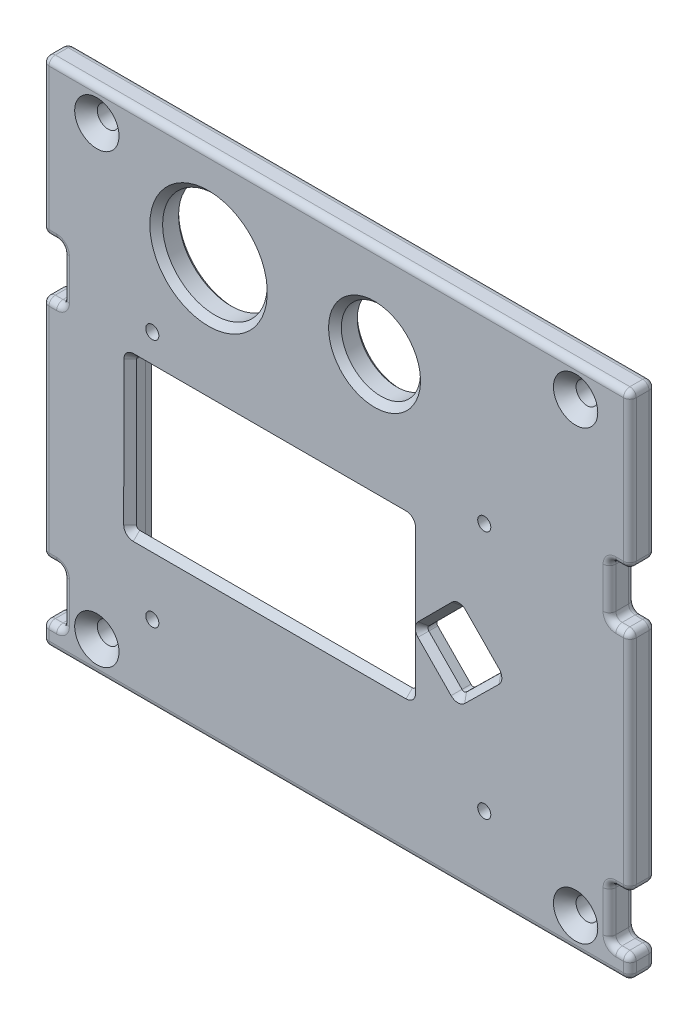
from build123d import *

# Parameters (mm, degrees)
SKETCH_1_W           = 92
SKETCH_1_H           = 80
EXTRUDE_1_DEPTH      = 4
FILLET_1_R           = 1
SKETCH_5_R           = 8.199999999999998
SKETCH_5_R_2         = 6.200000000000001
CUT_EXTRUDE_1_DEPTH  = 10
CUT_EXTRUDE_2_DEPTH  = 10
SKETCH_10_W          = 43.73798359101122
SKETCH_10_H          = 4.799999999999997
EXTRUDE_3_DEPTH      = 1
HOLE_WIZARD_M2_5_1_D = 2.05
CUT_EXTRUDE_4_DEPTH  = 1.6
SKETCH_13_W          = 7.00000000000005
SKETCH_13_H          = 7.000000000000006
SKETCH_13_R          = 1.0249999999999981
SKETCH_13_W_2        = 7.0000000000000355
SKETCH_13_H_2        = 7.000000000000021
SKETCH_13_W_3        = 6.999999999999954
SKETCH_13_W_4        = 6.999999999999968
SKETCH_13_H_3        = 7
EXTRUDE_4_DEPTH      = 1
FILLET_6_R           = 2
FILLET_3_R           = 0.5
CHAMFER_1_SIZE       = 1
CUT_EXTRUDE_3_DEPTH  = 3.2
FILLET_5_R           = 1
CHAMFER_2_SIZE       = 0.5
CHAMFER_3_SIZE       = 0.6


# Read off the part's stored shape, not the designer's step: M3 六角凹锥坑头螺钉的锥形沉头孔1
# Some blends are built 0.0001 mm under size
with BuildPart() as part:
    # 草图1 → 凸台-拉伸1 (new body)
    with BuildSketch(Plane.XY):
        Rectangle(SKETCH_1_W, SKETCH_1_H)
    extrude(amount=EXTRUDE_1_DEPTH)

    # 圆角1
    fillet_1_edges = [part.edges().sort_by_distance(p)[0] for p in [
        (46, -40, 2),
        (-46, -40, 2),
        (-46, 40, 2),
        (46, 40, 2),
    ]]
    fillet(fillet_1_edges, radius=FILLET_1_R)

    # 草图5 → 切除-拉伸1 (cut)
    with BuildSketch(Plane.XY.offset(4)):
        with Locations((-20.000000000000004, 25.4)):
            Circle(SKETCH_5_R)
        with Locations((5.999999999999995, 25.4)):
            Circle(SKETCH_5_R_2)
    extrude(amount=-CUT_EXTRUDE_1_DEPTH, mode=Mode.SUBTRACT)

    # 草图7 → 切除-拉伸2 (cut)
    with BuildSketch(Plane.XY.offset(4)):
        Polygon((11.437299974599982, 5.612700025400014), (-32.26201734237539, 5.612700025400005), (-32.30068361641124, -22.6872999746), (11.437299974599982, -22.687299974599995), align=None)
        Polygon((19.200336622309187, -2.5041402708626674), (25.146936780987943, -8.5702680987384), (19.054088686317147, -14.57075943490697), (13.163673741886969, -8.550780354971936), align=None)
    extrude(amount=-CUT_EXTRUDE_2_DEPTH, mode=Mode.SUBTRACT)

    # 草图10 → 凸台-拉伸3 (add)
    with BuildSketch(Plane.XY.offset(4)):
        with Locations((-10.43169182090563, -20.2872999746)):
            Rectangle(SKETCH_10_W, SKETCH_10_H)
    extrude(amount=-EXTRUDE_3_DEPTH)

    # M2.5 螺纹孔1 (through all)
    with Locations(Plane(origin=(0, 0, 0), x_dir=(-1, 0, 0), z_dir=(0, 0, -1))):
        with Locations((-23.187409195, -27.987294895), (28.812694945, -27.987294895), (28.812694945, 11.012783846), (-23.187409195, 11.012783846)):
            Hole(HOLE_WIZARD_M2_5_1_D / 2)

    # 草图12 → 切除-拉伸4 (cut)
    with BuildSketch(Plane(origin=(0, 0, 0), x_dir=(-1, 0, 0), z_dir=(0, 0, -1))):
        Polygon((32.31269494539003, -31.487294894589997), (-26.687409194817977, -31.487294894590004), (-26.687409194817985, 14.512783845568006), (32.31269494539002, 14.512783845568013), align=None)
    extrude(amount=-CUT_EXTRUDE_4_DEPTH, mode=Mode.SUBTRACT)

    # 草图13 → 凸台-拉伸4 (add)
    # profile 1 of 4: a face of its own
    with BuildSketch(Plane(origin=(0, 0, 1.6), x_dir=(-1, 0, 0), z_dir=(0, 0, -1))):
        with Locations((-23.18740919481796, 11.012783845568002)):
            Rectangle(SKETCH_13_W, SKETCH_13_H)
        with Locations((-23.18740919481796, 11.012783845568002)):
            Circle(SKETCH_13_R, mode=Mode.SUBTRACT)
    # profile 2 of 4: a face of its own
    with BuildSketch(Plane(origin=(0, 0, 1.6), x_dir=(-1, 0, 0), z_dir=(0, 0, -1))):
        with Locations((-23.18740919481796, -27.987294894589994)):
            Rectangle(SKETCH_13_W_2, SKETCH_13_H_2)
        with Locations((-23.18740919481796, -27.987294894589994)):
            Circle(SKETCH_13_R, mode=Mode.SUBTRACT)
    # profile 3 of 4: a face of its own
    with BuildSketch(Plane(origin=(0, 0, 1.6), x_dir=(-1, 0, 0), z_dir=(0, 0, -1))):
        with Locations((28.812694945390042, 11.012783845568004)):
            Rectangle(SKETCH_13_W_3, SKETCH_13_H_2)
        with Locations((28.812694945390042, 11.012783845568002)):
            Circle(SKETCH_13_R, mode=Mode.SUBTRACT)
    # profile 4 of 4: a face of its own
    with BuildSketch(Plane(origin=(0, 0, 1.6), x_dir=(-1, 0, 0), z_dir=(0, 0, -1))):
        with Locations((28.812694945390042, -27.987294894589994)):
            Rectangle(SKETCH_13_W_4, SKETCH_13_H_3)
        with Locations((28.812694945390042, -27.987294894589994)):
            Circle(SKETCH_13_R, mode=Mode.SUBTRACT)
    extrude(amount=EXTRUDE_4_DEPTH)

    # 圆角6
    fillet_6_edges = [part.edges().sort_by_distance(p)[0] for p in [
        (26.687409194817985, 14.512783845568006, 0.30000000000000004),
        (26.687409194817985, 7.512783845567999, 1.1),
        (19.687409194817935, 7.512783845567999, 1.1),
        (19.687409194817935, 14.512783845568006, 1.1),
        (26.687409194817977, -31.487294894590004, 0.30000000000000004),
        (19.687409194817942, -31.487294894590004, 1.1),
        (19.687409194817942, -24.487294894589986, 1.1),
        (26.687409194817977, -24.487294894589986, 1.1),
        (-32.31269494539002, 14.512783845568013, 0.30000000000000004),
        (-25.312694945390067, 14.512783845568013, 1.1),
        (-25.312694945390067, 7.512783845567992, 1.1),
        (-32.31269494539002, 7.512783845567992, 1.1),
        (-32.31269494539003, -31.487294894589997, 0.30000000000000004),
        (-32.31269494539003, -24.487294894589994, 1.1),
        (-25.31269494539006, -24.487294894589994, 1.1),
        (-25.31269494539006, -31.487294894589997, 1.1),
    ]]
    fillet(fillet_6_edges, radius=FILLET_6_R)

    # 圆角3
    fillet_3_edges = [part.edges().sort_by_distance(p)[0] for p in [
        (11.437299974599982, -17.8872999746, 3.5),
        (-32.29412537911894, -17.8872999746, 3.5),
        (11.437299974599982, -22.687299974599995, 2.3),
        (11.437299974599982, 5.612700025400014, 2.8),
        (-32.26201734237539, 5.612700025400005, 2.8),
        (-32.30068361641124, -22.6872999746, 2.3),
        (13.163673741886969, -8.550780354971936, 2.8),
        (19.054088686317147, -14.57075943490697, 2.8),
        (25.146936780987943, -8.5702680987384, 2.8),
        (19.200336622309187, -2.5041402708626674, 2.8),
    ]]
    fillet(fillet_3_edges, radius=FILLET_3_R)

    # 倒角1
    # the kernel refuses this chamfer: 1 mm, written as the material it takes off along each edge
    with BuildSketch(Plane(origin=(10.937299974599982, -17.8872999746, 4), x_dir=(0, -0.9996219169112968, 0.02749587661058651), z_dir=(-1, 0, 0))) as chamfer_1_piece_1:
        Polygon((CHAMFER_1_SIZE * 0.999621916911, -CHAMFER_1_SIZE * 0.0274958766106), (-CHAMFER_1_SIZE * 0.0274958766106, -CHAMFER_1_SIZE * 0.999621916911), (0, 0), align=None)
    extrude(amount=42.73074173730765, mode=Mode.SUBTRACT)
    with BuildSketch(Plane(origin=(10.937299974599982, -17.3872999746, 4), x_dir=(0, -1, 0), z_dir=(-1, 0, 0))) as chamfer_1_piece_2:
        Polygon((0.5 + CHAMFER_1_SIZE, 0), (0.5, -CHAMFER_1_SIZE), (0.5, 0), align=None)
    revolve(axis=Axis((10.937299974599982, -17.3872999746, 4), (0, 0, 1)), revolution_arc=90, mode=Mode.SUBTRACT)
    with BuildSketch(Plane(origin=(-31.793441762707673, -17.3872999746, 4), x_dir=(0, -1, 0), z_dir=(1, 0, 0))) as chamfer_1_piece_3:
        Polygon((0.5 + CHAMFER_1_SIZE, 0), (0.5, CHAMFER_1_SIZE), (0.5, 0), align=None)
    revolve(axis=Axis((-31.793441762707673, -17.3872999746, 4), (0, 0, -1)), revolution_arc=90.07828314251567, mode=Mode.SUBTRACT)
    with BuildSketch(Plane(origin=(11.437299974599982, -17.3872999746, 4), x_dir=(0.9996219169112968, 0, 0.02749587661058651), z_dir=(0, 1, 0))) as chamfer_1_piece_4:
        Polygon((CHAMFER_1_SIZE * 0.999621916911, CHAMFER_1_SIZE * 0.0274958766106), (-CHAMFER_1_SIZE * 0.0274958766106, CHAMFER_1_SIZE * 0.999621916911), (0, 0), align=None)
    extrude(amount=22.500000000000018, mode=Mode.SUBTRACT)
    with BuildSketch(Plane(origin=(-32.26269955870713, 5.113383174480311, 4), x_dir=(-0.9996209838784267, 0.001365781586382819, 0.02749587661058652), z_dir=(-0.0013662981606114724, -0.9999990666142325, 0))) as chamfer_1_piece_5:
        Polygon((CHAMFER_1_SIZE * 0.999621916911, CHAMFER_1_SIZE * 0.0274958766106), (-CHAMFER_1_SIZE * 0.0274958766106, CHAMFER_1_SIZE * 0.999621916911), (0, 0), align=None)
    extrude(amount=22.500021001199375, mode=Mode.SUBTRACT)
    with BuildSketch(Plane(origin=(10.937299974599982, 5.112700025400015, 4), x_dir=(1, 1.78e-15, 0), z_dir=(1.78e-15, -1, 0))) as chamfer_1_piece_6:
        Polygon((0.5 + CHAMFER_1_SIZE, 0), (0.5, -CHAMFER_1_SIZE), (0.5, 0), align=None)
    revolve(axis=Axis((10.937299974599982, 5.112700025400015, 4), (0, 0, 1)), revolution_arc=89.9999999999999, mode=Mode.SUBTRACT)
    with BuildSketch(Plane(origin=(-31.762700025400015, 5.112700025400005, 4), x_dir=(-0.9999990666142327, 0.0013662981606117287, 0), z_dir=(-0.0013662981606117287, -0.9999990666142327, 0))) as chamfer_1_piece_7:
        Polygon((0.5000000000000021 + CHAMFER_1_SIZE, 0), (0.5000000000000021, CHAMFER_1_SIZE), (0.5000000000000021, 0), align=None)
    revolve(axis=Axis((-31.762700025400015, 5.112700025400005, 4), (0, 0, -1)), revolution_arc=89.92171685748433, mode=Mode.SUBTRACT)
    with BuildSketch(Plane(origin=(10.937299974599982, 5.612700025400014, 4), x_dir=(0, 0.9996219169112968, 0.027495876610586487), z_dir=(-1, -2e-16, 0))) as chamfer_1_piece_8:
        Polygon((CHAMFER_1_SIZE * 0.999621916911, CHAMFER_1_SIZE * 0.0274958766106), (-CHAMFER_1_SIZE * 0.0274958766106, CHAMFER_1_SIZE * 0.999621916911), (0, 0), align=None)
    extrude(amount=42.699999999999996, mode=Mode.SUBTRACT)
    with BuildSketch(Plane(origin=(24.791516701281584, -8.920300641129165, 4), x_dir=(0.7014208532427678, -0.7122167952285337, 0.027495876610586514), z_dir=(-0.7124861742019344, -0.7016861489092477, 0))) as chamfer_1_piece_9:
        Polygon((CHAMFER_1_SIZE * 0.999621916911, -CHAMFER_1_SIZE * 0.0274958766106), (-CHAMFER_1_SIZE * 0.0274958766106, -CHAMFER_1_SIZE * 0.999621916911), (0, 0), align=None)
    extrude(amount=7.551063691821667, mode=Mode.SUBTRACT)
    with BuildSketch(Plane(origin=(19.060645145885807, -13.862534356110986, 4), x_dir=(0.7016861489092451, -0.7124861742019372, 0), z_dir=(0.7124861742019372, 0.7016861489092451, 0))) as chamfer_1_piece_10:
        Polygon((0.5000000000000011 + CHAMFER_1_SIZE, 0), (0.5000000000000011, CHAMFER_1_SIZE), (0.5000000000000011, 0), align=None)
    revolve(axis=Axis((19.060645145885807, -13.862534356110986, 4), (0, 0, -1)), revolution_arc=90.18569370135687, mode=Mode.SUBTRACT)
    with BuildSketch(Plane(origin=(24.44067362682696, -8.564057554028196, 4), x_dir=(0.7016861489092467, -0.7124861742019353, 0), z_dir=(-0.7124861742019353, -0.7016861489092467, 0))) as chamfer_1_piece_11:
        Polygon((0.4999999999999997 + CHAMFER_1_SIZE, 0), (0.500000000000001, -CHAMFER_1_SIZE), (0.4999999999999997, 0), align=None)
    revolve(axis=Axis((24.44067362682696, -8.564057554028196, 4), (0, 0, 1)), revolution_arc=89.86747992197152, mode=Mode.SUBTRACT)
    with BuildSketch(Plane(origin=(18.70326686109107, -14.212221018077338, 4), x_dir=(-0.7144863322179773, -0.6991089027062363, 0.027495876610586452), z_dir=(-0.6993733239327053, 0.7147565695894786, 0))) as chamfer_1_piece_12:
        Polygon((CHAMFER_1_SIZE * 0.999621916911, -CHAMFER_1_SIZE * 0.0274958766106), (-CHAMFER_1_SIZE * 0.0274958766106, -CHAMFER_1_SIZE * 0.999621916911), (0, 0), align=None)
    extrude(amount=7.4266133391607765, mode=Mode.SUBTRACT)
    with BuildSketch(Plane(origin=(19.554146873995485, -2.865062168463199, 4), x_dir=(0.7138372132482123, 0.6997716840166097, 0.027495876610586497), z_dir=(0.7000363559242622, -0.714107205105984, 0))) as chamfer_1_piece_13:
        Polygon((CHAMFER_1_SIZE * 0.999621916911, -CHAMFER_1_SIZE * 0.0274958766106), (-CHAMFER_1_SIZE * 0.0274958766106, -CHAMFER_1_SIZE * 0.999621916911), (0, 0), align=None)
    extrude(amount=7.490440047876282, mode=Mode.SUBTRACT)
    with BuildSketch(Plane(origin=(13.86666988931397, -8.554313682144963, 4), x_dir=(-0.7147565695894776, -0.6993733239327063, 0), z_dir=(0.6993733239327063, -0.7147565695894776, 0))) as chamfer_1_piece_14:
        Polygon((0.500000000000001 + CHAMFER_1_SIZE, 0), (0.4999999999999998, CHAMFER_1_SIZE), (0.500000000000001, 0), align=None)
    revolve(axis=Axis((13.86666988931397, -8.554313682144963, 4), (0, 0, -1)), revolution_arc=89.32943807985053, mode=Mode.SUBTRACT)
    with BuildSketch(Plane(origin=(19.197093271442494, -3.21508034642533, 4), x_dir=(0.7141072051059829, 0.700036355924263, 0), z_dir=(0.700036355924263, -0.7141072051059829, 0))) as chamfer_1_piece_15:
        Polygon((0.49999999999999944 + CHAMFER_1_SIZE, 0), (0.5000000000000004, -CHAMFER_1_SIZE), (0.49999999999999944, 0), align=None)
    revolve(axis=Axis((19.197093271442494, -3.21508034642533, 4), (0, 0, 1)), revolution_arc=90.61738829682062, mode=Mode.SUBTRACT)
    with BuildSketch(Plane(origin=(13.512824689711183, -8.201052341607875, 4), x_dir=(-0.7074228334336008, 0.706255556796682, 0.02749587661058647), z_dir=(0.7065226810741815, 0.7076903992055782, 0))) as chamfer_1_piece_16:
        Polygon((CHAMFER_1_SIZE * 0.999621916911, -CHAMFER_1_SIZE * 0.0274958766106), (-CHAMFER_1_SIZE * 0.0274958766106, -CHAMFER_1_SIZE * 0.999621916911), (0, 0), align=None)
    extrude(amount=7.544589190009113, mode=Mode.SUBTRACT)
    with BuildSketch(Plane(origin=(-20.000000000000004, 25.4, 4), x_dir=(1, 0, 0), z_dir=(0, -1, 0))) as chamfer_1_piece_17:
        Polygon((8.199999999999998 + CHAMFER_1_SIZE, 0), (8.199999999999998, -CHAMFER_1_SIZE), (8.199999999999998, 0), align=None)
    revolve(axis=Axis((-20.000000000000004, 25.4, 4), (0, 0, 1)), mode=Mode.SUBTRACT)
    with BuildSketch(Plane(origin=(5.999999999999995, 25.4, 4), x_dir=(1, 0, 0), z_dir=(0, -1, 0))) as chamfer_1_piece_18:
        Polygon((6.200000000000001 + CHAMFER_1_SIZE, 0), (6.200000000000001, -CHAMFER_1_SIZE), (6.200000000000001, 0), align=None)
    revolve(axis=Axis((5.999999999999995, 25.4, 4), (0, 0, 1)), mode=Mode.SUBTRACT)

    # 草图11 → 切除-拉伸3 (cut)
    with BuildSketch(Plane.ZY.offset(46)):
        with BuildLine():
            Line((4.222567200682733, 15.824999999999774), (4.222567200682733, 7.42499999999978))
            Line((4.222567200682733, 7.42499999999978), (-5.977432799317274, 7.42499999999978))
            ThreePointArc((-5.977432799317274, 7.42499999999978), (-10.177432799317266, 11.624999999999783), (-5.977432799317271, 15.824999999999774))
            Line((-5.977432799317271, 15.824999999999774), (4.222567200682733, 15.824999999999774))
        make_face()
        with BuildLine():
            Line((4.2225672006827075, -28.050000000000242), (-5.977432799317311, -28.050000000000242))
            ThreePointArc((-5.977432799317311, -28.050000000000242), (-10.177432799317293, -32.25000000000021), (-5.977432799317323, -36.450000000000216))
            Line((-5.977432799317323, -36.450000000000216), (4.2225672006827075, -36.45000000000021))
            Line((4.2225672006827075, -36.45000000000021), (4.2225672006827075, -28.050000000000242))
        make_face()
        with BuildLine():
            Line((-5.977432799317244, 51.49999999999978), (4.022567200682756, 51.499999999999766))
            Line((4.022567200682756, 51.499999999999766), (4.022567200682734, 15.624999999999773))
            Line((4.022567200682734, 15.624999999999773), (-5.977432799317271, 15.624999999999782))
            ThreePointArc((-5.977432799317271, 15.624999999999782), (-9.977432799317274, 11.624999999999783), (-5.977432799317274, 7.62499999999978))
            Line((-5.977432799317274, 7.62499999999978), (4.0225672006827295, 7.624999999999764))
            Line((4.0225672006827295, 7.624999999999764), (4.022567200682707, -28.25000000000024))
            Line((4.022567200682707, -28.25000000000024), (-5.977432799317311, -28.250000000000227))
            ThreePointArc((-5.977432799317311, -28.250000000000227), (-9.977432799317308, -32.25000000000021), (-5.977432799317323, -36.25000000000021))
            Line((-5.977432799317323, -36.25000000000021), (4.022567200682703, -36.25000000000023))
            Line((4.022567200682703, -36.25000000000023), (4.022567200682702, -38.00000000000021))
            Line((4.022567200682702, -38.00000000000021), (8.922567200682705, -38.00000000000021))
            Line((8.922567200682705, -38.00000000000021), (8.922567200682781, 90.49999999999979))
            Line((8.922567200682781, 90.49999999999979), (4.02256720068278, 90.49999999999979))
            Line((4.02256720068278, 90.49999999999979), (4.0225672006827615, 59.499999999999766))
            Line((4.0225672006827615, 59.499999999999766), (-5.9774327993172385, 59.499999999999766))
            ThreePointArc((-5.9774327993172385, 59.499999999999766), (-9.977432799317235, 55.49999999999978), (-5.977432799317244, 51.49999999999978))
        make_face()
    cut_extrude_3 = extrude(amount=-CUT_EXTRUDE_3_DEPTH, mode=Mode.SUBTRACT)

    # 镜向2: 切除-拉伸3 across plane
    add(cut_extrude_3.mirror(Plane(origin=(0, 0, 0), x_dir=(0, 0, 1), z_dir=(1, 0, 0))), mode=Mode.SUBTRACT)

    # 圆角5
    fillet_5_edges = [part.edges().sort_by_distance(p)[0] for p in [
        (46, -37.72500000000011, 0),
        (46, -37.72500000000011, 4),
        (0, -40, 0),
        (-46, 27.412499999999888, 0),
        (0, 40, 0),
        (45.707106781186546, 39.707106781186546, 0),
        (-45.707106781186546, 39.707106781186546, 0),
        (-45.707106781186546, -39.707106781186546, 0),
        (45.707106781186546, -39.707106781186546, 0),
        (0, -40, 4),
        (0, 40, 4),
        (-46, 27.412499999999888, 4),
        (45.707106781186546, 39.707106781186546, 4),
        (-45.707106781186546, 39.707106781186546, 4),
        (-45.707106781186546, -39.707106781186546, 4),
        (45.707106781186546, -39.707106781186546, 4),
        (-46, -10.312500000000227, 0),
        (-46, -37.72500000000011, 0),
        (-46, -10.312500000000227, 4),
        (-46, -37.72500000000011, 4),
        (-46, 7.42499999999978, 2),
        (-46, 15.824999999999774, 1.9999999999999991),
        (-46, -36.45000000000021, 2.000000000000001),
        (-46, -28.050000000000242, 2),
        (-42.8, 11.624999999999778, 0),
        (-42.8, -32.25000000000023, 0),
        (-44.4, -28.050000000000242, 4),
        (-42.8, -28.050000000000242, 2),
        (-44.4, -28.050000000000242, 0),
        (-42.8, -36.45000000000021, 2.000000000000001),
        (-44.4, -36.45000000000021, 4),
        (-44.4, -36.45000000000021, 0),
        (-42.8, -32.25000000000023, 4),
        (-44.4, 15.824999999999774, 3.9999999999999996),
        (-42.8, 15.824999999999774, 1.9999999999999991),
        (-44.4, 15.824999999999774, 0),
        (-42.8, 7.42499999999978, 2),
        (-44.4, 7.42499999999978, 4),
        (-44.4, 7.42499999999978, 0),
        (-42.8, 11.624999999999778, 4),
        (46, -10.312500000000231, 4),
        (46, 27.41249999999988, 4),
        (46, -10.312500000000231, 0),
        (46, 27.41249999999988, 0),
        (46, 7.42499999999978, 2),
        (46, 15.824999999999774, 1.9999999999999991),
        (46, -36.45000000000021, 2.000000000000001),
        (46, -28.050000000000242, 2),
        (42.8, 11.624999999999778, 0),
        (42.8, -32.25000000000023, 0),
        (42.8, -28.050000000000242, 2),
        (42.8, -36.45000000000021, 2.000000000000001),
        (44.4, -28.050000000000242, 0),
        (44.4, -36.45000000000021, 0),
        (44.4, -28.050000000000242, 4),
        (44.4, -36.45000000000021, 4),
        (42.8, -32.25000000000023, 4),
        (42.8, 15.824999999999774, 1.9999999999999991),
        (42.8, 7.42499999999978, 2),
        (44.4, 15.824999999999774, 0),
        (44.4, 7.42499999999978, 0),
        (44.4, 15.824999999999774, 3.9999999999999996),
        (44.4, 7.42499999999978, 4),
        (42.8, 11.624999999999778, 4),
    ]]
    fillet(fillet_5_edges, radius=FILLET_5_R)

    # 倒角2
    chamfer_2_edges = [part.edges().sort_by_distance(p)[0] for p in [
        (-28.200000000000003, 25.4, 0),
        (-0.2000000000000064, 25.4, 0),
    ]]
    chamfer(chamfer_2_edges, length=CHAMFER_2_SIZE)

    # 倒角3
    chamfer_3_edges = [part.edges().sort_by_distance(p)[0] for p in [
        (-2.812642875286027, -31.48729489459, 0),
        (-31.726908507763124, -30.901508456963093, 0),
        (26.10162275719107, -30.9015084569631, 0),
        (-32.31269494539002, -8.487255524510992, 0),
        (26.68740919481798, -8.487255524511, 0),
        (-31.726908507763117, 13.926997407941109, 0),
        (26.10162275719108, 13.926997407941101, 0),
        (-2.81264287528602, 14.51278384556801, 0),
    ]]
    chamfer(chamfer_3_edges, length=CHAMFER_3_SIZE - 0.0001)  # a hair under: the kernel refuses the full size

    # M3 六角凹锥坑头螺钉的锥形沉头孔1 outline → M3 六角凹锥坑头螺钉的锥形沉头孔1 (revolve, cut)
    with BuildSketch(Plane(origin=(37.5, 35, 0), x_dir=(1, 0, 0), z_dir=(0, -1, 0))):
        Polygon((0, 0), (1.7, 0), (1.7, 2.23), (3.47, 4), (0, 4), align=None)
    revolve(axis=Axis((37.5, 35, 0), (0, 0, 1)), mode=Mode.SUBTRACT)

    # Hole Wizard M3 _1 2 outline → Hole Wizard M3 _1 2 (revolve, cut)
    with BuildSketch(Plane(origin=(-37.5, -35, 0), x_dir=(1, 0, 0), z_dir=(0, -1, 0))):
        Polygon((0, 0), (1.7, 0), (1.7, 2.23), (3.47, 4), (0, 4), align=None)
    revolve(axis=Axis((-37.5, -35, 0), (0, 0, 1)), mode=Mode.SUBTRACT)

    # Hole Wizard M3 _1 3 outline → Hole Wizard M3 _1 3 (revolve, cut)
    with BuildSketch(Plane(origin=(-37.5, 35, 0), x_dir=(1, 0, 0), z_dir=(0, -1, 0))):
        Polygon((0, 0), (1.7, 0), (1.7, 2.23), (3.47, 4), (0, 4), align=None)
    revolve(axis=Axis((-37.5, 35, 0), (0, 0, 1)), mode=Mode.SUBTRACT)

    # Hole Wizard M3 _1 4 outline → Hole Wizard M3 _1 4 (revolve, cut)
    with BuildSketch(Plane(origin=(37.5, -35, 0), x_dir=(1, 0, 0), z_dir=(0, -1, 0))):
        Polygon((0, 0), (1.7, 0), (1.7, 2.23), (3.47, 4), (0, 4), align=None)
    revolve(axis=Axis((37.5, -35, 0), (0, 0, 1)), mode=Mode.SUBTRACT)


solid = part.part
